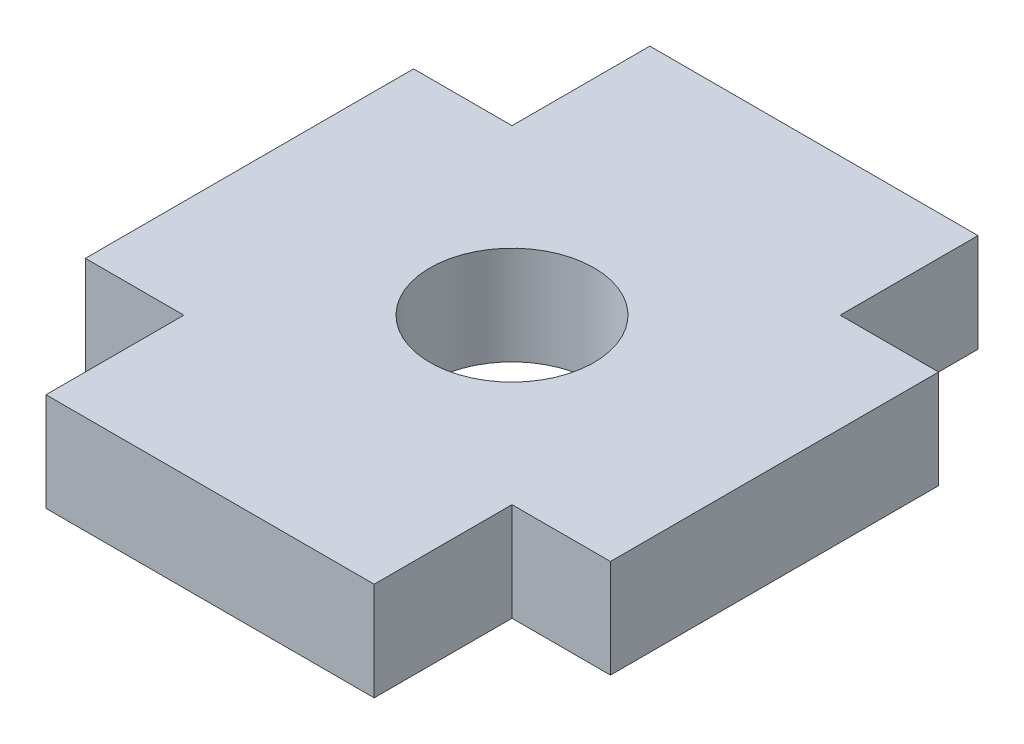
from build123d import *

# Parameters (mm, degrees)
ESBO_O1_R                = 2.5
RESSALTO_EXTRUS_O1_DEPTH = 3


with BuildPart() as part:
    # Esboço1 → Ressalto-extrusão1 (new body)
    with BuildSketch(Plane.XZ.offset(-10)):
        Polygon((-66.5, -9.199919627), (-66.5, -5), (-63.5, -5), (-63.5, 5), (-66.5, 5), (-66.5, 9.199919627), (-76.5, 9.199919627), (-76.5, 5), (-79.5, 5), (-79.5, -5), (-76.5, -5), (-76.5, -9.199919627), align=None)
        with Locations((-71.5, 0)):
            Circle(ESBO_O1_R, mode=Mode.SUBTRACT)
    extrude(amount=-RESSALTO_EXTRUS_O1_DEPTH)


solid = part.part
